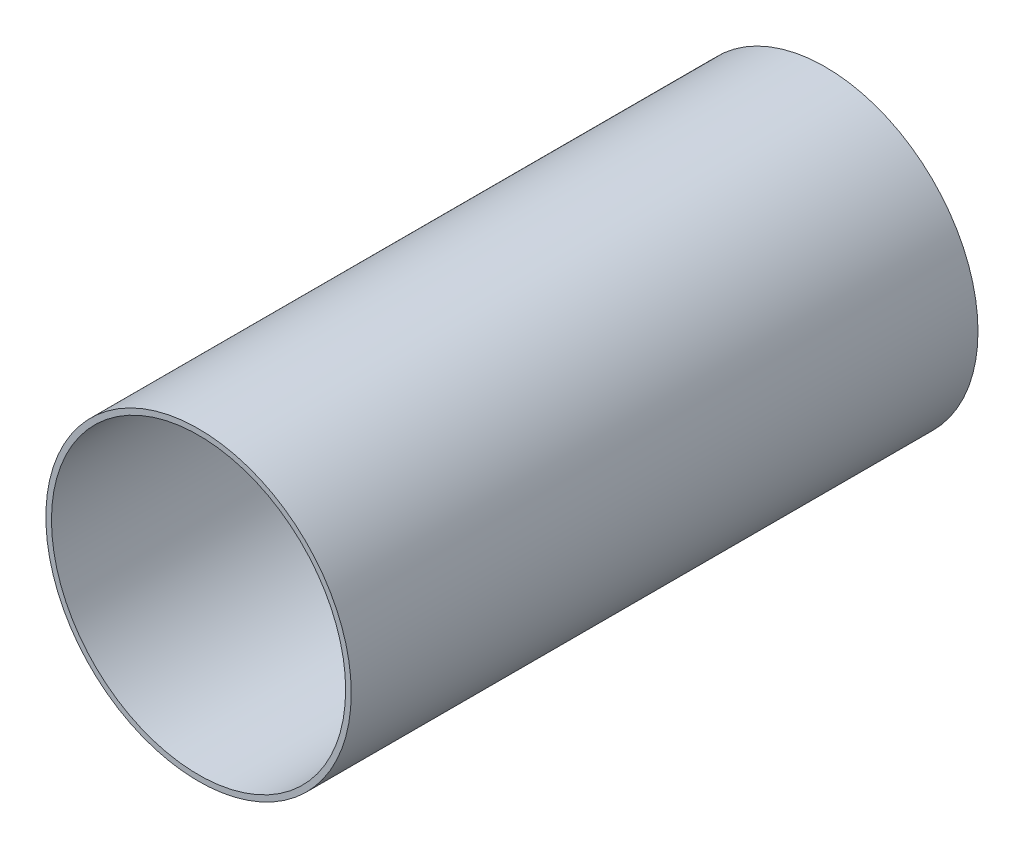
from build123d import *

# Parameters (mm, degrees)
SKETCH1_R           = 49.5046
SKETCH1_R_2         = 47.6885
BOSS_EXTRUDE1_DEPTH = 203.2


with BuildPart() as part:
    # Sketch1 → Boss-Extrude1 (new body)
    with BuildSketch(Plane.XY):
        Circle(SKETCH1_R)
        Circle(SKETCH1_R_2, mode=Mode.SUBTRACT)
    extrude(amount=BOSS_EXTRUDE1_DEPTH)


solid = part.part
